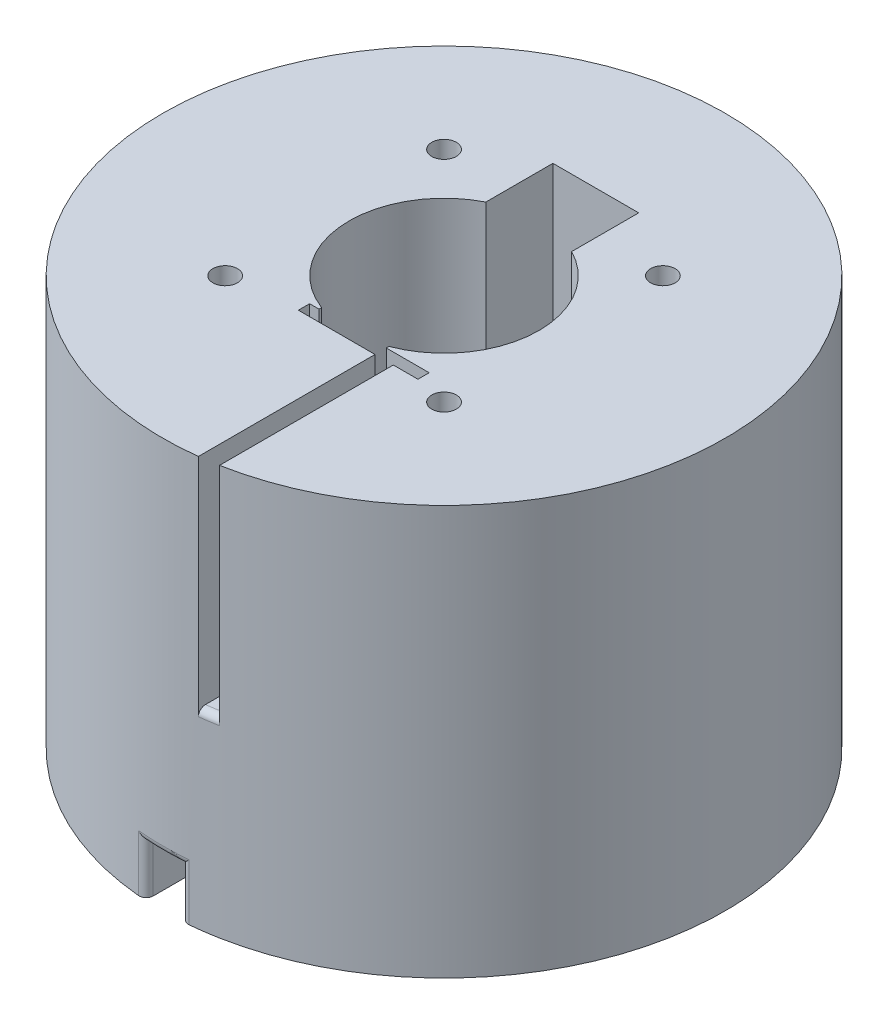
from build123d import *

# Parameters (mm, degrees)
SKETCH1_R           = 40
SKETCH1_W           = 12.2
SKETCH1_H           = 22.7
BOSS_EXTRUDE1_DEPTH = 16.35
SKETCH3_W           = 5
SKETCH3_H           = 34.105
CUT_EXTRUDE1_DEPTH  = 7
SKETCH4_R           = 1.75
CUT_EXTRUDE2_DEPTH  = 8
SKETCH2_R           = 40
SKETCH2_W           = 12.2
SKETCH2_H           = 32.25
BOSS_EXTRUDE2_DEPTH = 8.3
SKETCH5_R           = 1
CUT_EXTRUDE3_DEPTH  = 8
SKETCH6_R           = 40
BOSS_EXTRUDE3_DEPTH = 2.5
BOSS_EXTRUDE4_DEPTH = 31.05
CUT_EXTRUDE4_START  = -8
SKETCH8_R           = 1.75
CUT_EXTRUDE4_DEPTH  = 8
FILLET1_R           = 1


with BuildPart() as part:
    # Sketch1 → Boss-Extrude1 (new body)
    with BuildSketch(Plane(origin=(0, 0, 0), x_dir=(1, 0, 0), z_dir=(0, 1, 0))):
        with Locations(Location((0, 0, 0), (0, 0, 270))):
            Circle(SKETCH1_R)
        with Locations((0, 5.455)):
            Rectangle(SKETCH1_W, SKETCH1_H, mode=Mode.SUBTRACT)
    extrude(amount=BOSS_EXTRUDE1_DEPTH)

    # Sketch3 → Cut-Extrude1 (cut)
    with BuildSketch(Plane.XZ):
        with Locations((0, 22.9475)):
            Rectangle(SKETCH3_W, SKETCH3_H)
    extrude(amount=-CUT_EXTRUDE1_DEPTH, mode=Mode.SUBTRACT)

    # Sketch4 → Cut-Extrude2 (cut)
    with BuildSketch(Plane.XZ):
        with Locations(Location((-15.556349186, 15.556349186, 0), (0, 0, 270))):
            Circle(SKETCH4_R)
        with Locations(Location((15.556349186, 15.556349186, 0), (0, 0, 270))):
            Circle(SKETCH4_R)
        with Locations(Location((15.556349186, -15.556349186, 0), (0, 0, 270))):
            Circle(SKETCH4_R)
        with Locations(Location((-15.556349186, -15.556349186, 0), (0, 0, 270))):
            Circle(SKETCH4_R)
    extrude(amount=-CUT_EXTRUDE2_DEPTH, mode=Mode.SUBTRACT)

    # Sketch2 → Boss-Extrude2 (add)
    with BuildSketch(Plane(origin=(0, 16.35, 0), x_dir=(1, 0, 0), z_dir=(0, 1, 0))):
        with Locations(Location((0, 0, 0), (0, 0, 266.416678302))):
            Circle(SKETCH2_R)
        with Locations((0, 5.455)):
            Rectangle(SKETCH2_W, SKETCH2_H, mode=Mode.SUBTRACT)
    extrude(amount=BOSS_EXTRUDE2_DEPTH)

    # Sketch5 → Cut-Extrude3 (cut)
    with BuildSketch(Plane(origin=(0, 16.35, 0), x_dir=(1, 0, 0), z_dir=(0, 1, 0))):
        with Locations(Location((0, 19.58, 0), (0, 0, 270))):
            Circle(SKETCH5_R)
        with Locations(Location((0, -8.67, 0), (0, 0, 90))):
            Circle(SKETCH5_R)
    extrude(amount=-CUT_EXTRUDE3_DEPTH, mode=Mode.SUBTRACT)

    # Sketch6 → Boss-Extrude3 (add)
    with BuildSketch(Plane(origin=(0, 24.65, 0), x_dir=(1, 0, 0), z_dir=(0, 1, 0))):
        with Locations(Location((0, 0, 0), (0, 0, 266.416678302))):
            Circle(SKETCH6_R)
        with BuildLine():
            Line((6.1, 12.043255374), (6.1, 21.58))
            Line((6.1, 21.58), (-6.1, 21.58))
            Line((-6.1, 21.58), (-6.1, 12.043255374))
            ThreePointArc((-6.1, 12.043255374), (0, -13.5), (6.1, 12.043255374))
        make_face(mode=Mode.SUBTRACT)
    extrude(amount=BOSS_EXTRUDE3_DEPTH)

    # Sketch7 → Boss-Extrude4 (add)
    with BuildSketch(Plane(origin=(0, 27.15, 0), x_dir=(1, 0, 0), z_dir=(0, 1, 0))):
        with BuildLine():
            ThreePointArc((-4.790054945, -12.621623256), (-13.48100084, -0.715972321), (-6.1, 12.043255374))
            Line((-6.1, 12.043255374), (-6.1, 21.58))
            Line((-6.1, 21.58), (6.1, 21.58))
            Line((6.1, 21.58), (6.1, 12.043255374))
            ThreePointArc((6.1, 12.043255374), (13.480999281, -0.716001663), (4.79, -12.621644108))
            Line((4.79, -12.621644108), (4.79, -13))
            Line((4.79, -13), (10.89, -13))
            Line((10.89, -13), (10.89, -14.6))
            Line((10.89, -14.6), (7.39, -14.6))
            Line((7.39, -14.6), (7.39, -39.311422004))
            ThreePointArc((7.39, -39.311422004), (30.786360616, -25.538206672), (40, 0))
            ThreePointArc((40, 0), (-29.929918142, 26.536766947), (4.79, -39.712163124))
            Line((4.79, -39.712163124), (4.79, -14.6))
            Line((4.79, -14.6), (-6.11, -14.6))
            Line((-6.11, -14.6), (-6.11, -13))
            Line((-6.11, -13), (-4.790054945, -13))
            Line((-4.790054945, -13), (-4.790054945, -12.621623256))
        make_face()
    extrude(amount=BOSS_EXTRUDE4_DEPTH)

    # Sketch8 → Cut-Extrude4 (cut)
    with BuildSketch(Plane(origin=(0, 58.2, 0), x_dir=(1, 0, 0), z_dir=(0, 1, 0)).offset(CUT_EXTRUDE4_START)):
        with Locations(Location((-15.556349186, 15.556349186, 0), (0, 0, 90))):
            Circle(SKETCH8_R)
        with Locations(Location((15.556349186, 15.556349186, 0), (0, 0, 90))):
            Circle(SKETCH8_R)
        with Locations(Location((15.556349186, -15.556349186, 0), (0, 0, 90))):
            Circle(SKETCH8_R)
        with Locations(Location((-15.556349186, -15.556349186, 0), (0, 0, 90))):
            Circle(SKETCH8_R)
    extrude(amount=CUT_EXTRUDE4_DEPTH, mode=Mode.SUBTRACT)

    # Fillet1
    # the kernel refuses this fillet: 1 mm, written as the material it takes off along each edge
    with BuildSketch(Plane(origin=(-2.5, 7, 39.921798557), x_dir=(-0.9970979844940963, 0, -0.07612889936030137), z_dir=(0, -1, 0))) as fillet1_piece_1:
        with BuildLine():
            CenterArc((1.079253806, 0.999906678), FILLET1_R, 175.633911064, 95.148856173)
            Line((0.082155822, 1.076035578), (0, 0))
            ThreePointArc((0, 0), (0.546457623, -0.003732873), (1.092915247, 0))
        make_face()
    extrude(amount=9.732288117, mode=Mode.SUBTRACT)
    with BuildSketch(Plane(origin=(2.5, 7, 39.921798557), x_dir=(0.9970979844940963, 0, -0.07612889936030175), z_dir=(0, -1, 0))) as fillet1_piece_2:
        with BuildLine():
            CenterArc((1.079253806, -0.999906678), FILLET1_R, 89.217232763, 95.148856173)
            Line((0.082155822, -1.076035578), (0, 0))
            ThreePointArc((0, 0), (0.546457623, 0.003732873), (1.092915247, 0))
        make_face()
    extrude(amount=9.732288117, mode=Mode.SUBTRACT)
    with BuildSketch(Plane(origin=(0, 7, 0), x_dir=(0.12471521651868436, 0, 0.9921925794767352), z_dir=(0.9921925794767352, 0, -0.12471521651868436))) as fillet1_piece_3_section:
        with BuildLine():
            CenterArc((40 - FILLET1_R, -FILLET1_R), FILLET1_R, 0, 90)
            Line((40 - FILLET1_R, 0), (40, 0))
            Line((40, 0), (40, -FILLET1_R))
        make_face()
    fillet1_piece_3 = revolve(axis=Axis((0, 7, 0), (0, -1, 0)), revolution_arc=7.164310198, mode=Mode.PRIVATE)
    fillet1_piece_3 = split(fillet1_piece_3, bisect_by=Plane(origin=(2.5, 7.226394193, 39.747383267), z_dir=(-1, 0, 0)), keep=Keep.TOP, mode=Mode.PRIVATE)
    add(fillet1_piece_3, mode=Mode.SUBTRACT)
    with BuildSketch(Plane(origin=(0, 27.15, 0), x_dir=(0.057506279993827, 0, 0.9983451446074506), z_dir=(-0.9983451446074506, 0, 0.057506279993827))) as fillet1_piece_4_section:
        with BuildLine():
            CenterArc((40 - FILLET1_R, -FILLET1_R), FILLET1_R, 0, 90)
            Line((40 - FILLET1_R, 0), (40, 0))
            Line((40, 0), (40, -FILLET1_R))
        make_face()
    fillet1_piece_4 = revolve(axis=Axis((0, 27.15, 0), (0, 1, 0)), revolution_arc=10.930860095, mode=Mode.PRIVATE)
    fillet1_piece_4 = split(fillet1_piece_4, bisect_by=Plane(origin=(4.79, 26.923621973, 39.296870163), z_dir=(1, 0, 0)), keep=Keep.TOP, mode=Mode.PRIVATE)
    fillet1_piece_4 = split(fillet1_piece_4, bisect_by=Plane(origin=(7.39, 26.923621973, 39.296870163), z_dir=(-1, 0, 0)), keep=Keep.TOP, mode=Mode.PRIVATE)
    add(fillet1_piece_4, mode=Mode.SUBTRACT)
    with BuildSketch(Plane(origin=(0, 7, 0), x_dir=(0, 0, 1), z_dir=(1, 0, 0))) as fillet1_piece_5_section:
        with BuildLine():
            CenterArc((40 - FILLET1_R, -FILLET1_R), FILLET1_R, 0, 90)
            Line((40 - FILLET1_R, 0), (40, 0))
            Line((40, 0), (40, -FILLET1_R))
        make_face()
    fillet1_piece_5 = revolve(axis=Axis((0, 7, 0), (0, -1, 0)), revolution_arc=7.164310198, mode=Mode.PRIVATE)
    fillet1_piece_5 = split(fillet1_piece_5, bisect_by=Plane(origin=(-2.5, 7.226394086, 39.74738287), z_dir=(1, 0, 0)), keep=Keep.TOP, mode=Mode.PRIVATE)
    add(fillet1_piece_5, mode=Mode.SUBTRACT)
    with BuildSketch(Plane(origin=(0, 7, 0), x_dir=(0, 0, 1), z_dir=(1, 0, 0))) as fillet1_piece_6a_section:
        with BuildLine():
            CenterArc((40 - FILLET1_R, -FILLET1_R), FILLET1_R, 0, 90)
            Line((40 - FILLET1_R, 0), (40, 0))
            Line((40, 0), (40, -FILLET1_R))
        make_face()
    fillet1_piece_6a = revolve(axis=Axis((0, 7, 0), (0, -1, 0)), revolution_arc=7.164310198, mode=Mode.PRIVATE)
    fillet1_piece_6a = split(fillet1_piece_6a, bisect_by=Plane(origin=(-2.5, 7.227785013, 39.594106119), z_dir=(-1, 0, 0)), keep=Keep.TOP, mode=Mode.PRIVATE)
    with BuildSketch(Plane(origin=(-2.5, 9.732288117, 39.921798557), x_dir=(-0.9970979844940969, 0, -0.07612889936029517), z_dir=(0, -1, 0))) as fillet1_piece_6b_section:
        with BuildLine():
            CenterArc((1.079253806, 0.999906678), FILLET1_R, 175.633911064, 95.148856173)
            Line((0.082155822, 1.076035578), (0, 0))
            ThreePointArc((0, 0), (0.546457623, -0.003732873), (1.092915247, 0))
        make_face()
    fillet1_piece_6b = extrude(amount=12.464576234, mode=Mode.PRIVATE)
    fillet1_piece_6b = split(fillet1_piece_6b, bisect_by=Plane(origin=(-2.749431224, 7, 39.658633208), z_dir=(0, 1, 0)), keep=Keep.TOP, mode=Mode.PRIVATE)
    fillet1_piece_6 = fillet1_piece_6a & fillet1_piece_6b
    add(fillet1_piece_6, mode=Mode.SUBTRACT)
    with BuildSketch(Plane(origin=(2.5, 9.732288117, 39.921798557), x_dir=(0.9970979844940969, 0, -0.07612889936029532), z_dir=(0, -1, 0))) as fillet1_piece_7a_section:
        with BuildLine():
            CenterArc((1.079253806, -0.999906678), FILLET1_R, 89.217232763, 95.148856173)
            Line((0.082155822, -1.076035578), (0, 0))
            ThreePointArc((0, 0), (0.546457623, 0.003732873), (1.092915247, 0))
        make_face()
    fillet1_piece_7a = extrude(amount=12.464576234, mode=Mode.PRIVATE)
    fillet1_piece_7a = split(fillet1_piece_7a, bisect_by=Plane(origin=(2.749431224, 7, 39.658633208), z_dir=(0, 1, 0)), keep=Keep.TOP, mode=Mode.PRIVATE)
    with BuildSketch(Plane(origin=(0, 7, 0), x_dir=(0.12471521651868436, 0, 0.9921925794767352), z_dir=(0.9921925794767352, 0, -0.12471521651868436))) as fillet1_piece_7b_section:
        with BuildLine():
            CenterArc((40 - FILLET1_R, -FILLET1_R), FILLET1_R, 0, 90)
            Line((40 - FILLET1_R, 0), (40, 0))
            Line((40, 0), (40, -FILLET1_R))
        make_face()
    fillet1_piece_7b = revolve(axis=Axis((0, 7, 0), (0, -1, 0)), revolution_arc=7.164310198, mode=Mode.PRIVATE)
    fillet1_piece_7b = split(fillet1_piece_7b, bisect_by=Plane(origin=(2.5, 7.227784999, 39.594105903), z_dir=(1, 0, 0)), keep=Keep.TOP, mode=Mode.PRIVATE)
    fillet1_piece_7 = fillet1_piece_7a & fillet1_piece_7b
    add(fillet1_piece_7, mode=Mode.SUBTRACT)


solid = part.part
